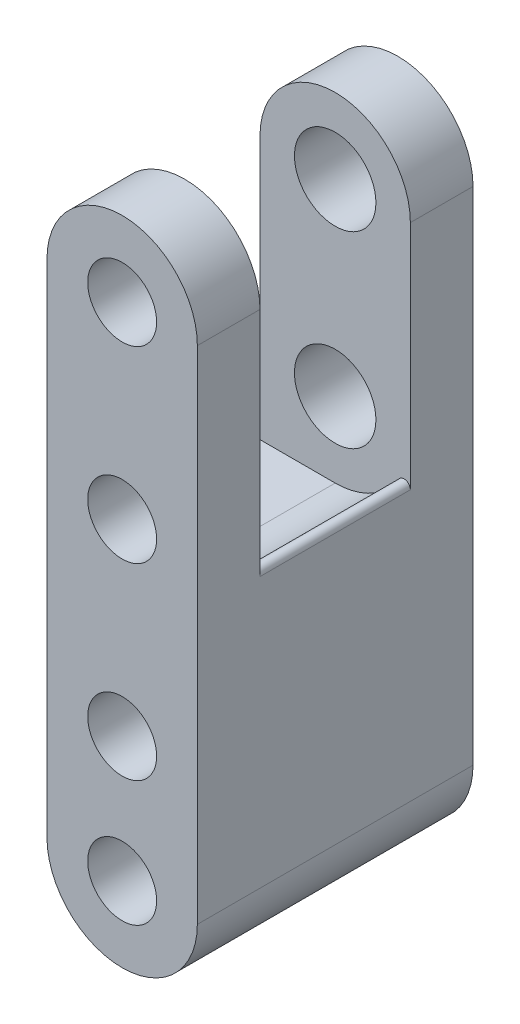
from build123d import *

# Parameters (mm, degrees)
BOSS_EXTRUDE1_DEPTH  = 11
M5_CLEARANCE_HOLE1_D = 5.5
CUT_EXTRUDE1_DEPTH   = 6
SKETCH1_4_R          = 3.25
CUT_EXTRUDE2_DEPTH   = 48.675989764
FILLET1_R            = 0.5


with BuildPart() as part:
    # Sketch1 → Boss-Extrude1 (new, symmetric)
    with BuildSketch(Plane.XY):
        with BuildLine():
            ThreePointArc((6, 0), (0, 6), (-6, 0))
            Line((-6, 0), (-6, -40))
            ThreePointArc((-6, -40), (0, -46), (6, -40))
            Line((6, -40), (6, 0))
        make_face()
    extrude(amount=BOSS_EXTRUDE1_DEPTH, both=True)

    # M5 Clearance Hole1 (through all)
    with Locations(Plane.XY.offset(11)):
        with Locations((0, 0), (0, -15), (0, -30), (0, -40)):
            Hole(M5_CLEARANCE_HOLE1_D / 2)

    # Sketch1<3> → Cut-Extrude1 (cut, symmetric)
    with BuildSketch(Plane.XY):
        with BuildLine():
            Line((6, -15), (6, 0))
            ThreePointArc((6, 0), (0, 6), (-6, 0))
            Line((-6, 0), (-6, -21))
            Line((-6, -21), (0, -21))
            ThreePointArc((0, -21), (4.242640687, -19.242640687), (6, -15))
        make_face()
    extrude(amount=CUT_EXTRUDE1_DEPTH, both=True, mode=Mode.SUBTRACT)

    # Sketch1<4> → Cut-Extrude2 (cut, through all)
    with BuildSketch(Plane.XY):
        Circle(SKETCH1_4_R)
        with Locations((0, -15)):
            Circle(SKETCH1_4_R)
    extrude(amount=-CUT_EXTRUDE2_DEPTH, mode=Mode.SUBTRACT)

    # Fillet1
    fillet1_edges = [part.edges().sort_by_distance(p)[0] for p in [
        (6, -15, 0),
    ]]
    fillet(fillet1_edges, radius=FILLET1_R)


solid = part.part
